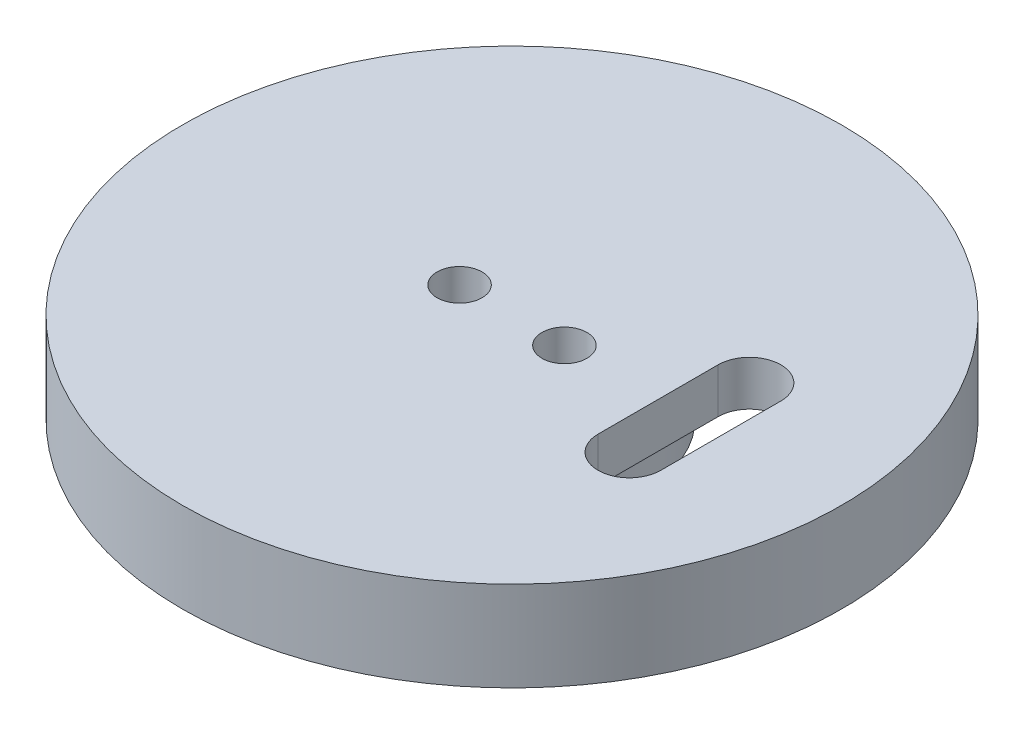
from build123d import *

# Parameters (mm, degrees)
ESQUISSE1_R             = 22
ESQUISSE1_R_2           = 1.5
BOSS_EXTRU_1_DEPTH      = 6
ESQUISSE2_R             = 16.25
ESQUISSE2_R_2           = 8.65
ENL_V_MAT_EXTRU_1_DEPTH = 3
ENL_V_MAT_EXTRU_2_DEPTH = 3


with BuildPart() as part:
    # Esquisse1 → Boss.-Extru.1 (new body)
    with BuildSketch(Plane(origin=(0, 0, 0), x_dir=(1, 0, 0), z_dir=(0, 1, 0))):
        Circle(ESQUISSE1_R)
        with Locations((-3.5, 0)):
            Circle(ESQUISSE1_R_2, mode=Mode.SUBTRACT)
        with Locations((3.5, 0)):
            Circle(ESQUISSE1_R_2, mode=Mode.SUBTRACT)
    extrude(amount=BOSS_EXTRU_1_DEPTH)

    # Esquisse2 → Enlèv. mat.-Extru.1 (cut)
    with BuildSketch(Plane.XZ):
        Circle(ESQUISSE2_R)
        Circle(ESQUISSE2_R_2, mode=Mode.SUBTRACT)
    extrude(amount=-ENL_V_MAT_EXTRU_1_DEPTH, mode=Mode.SUBTRACT)

    # Esquisse3 → Enlèv. mat.-Extru.2 (cut)
    with BuildSketch(Plane(origin=(0, 3, 0), x_dir=(-1, 0, 0), z_dir=(0, -1, 0))):
        with BuildLine():
            Line((-13.940625792, -4.008679646), (-13.940625792, 4.008679646))
            ThreePointArc((-13.940625792, 4.008679646), (-11.846146155, 6.103159283), (-9.751666518, 4.008679646))
            Line((-9.751666518, 4.008679646), (-9.751666518, -4.008679646))
            ThreePointArc((-9.751666518, -4.008679646), (-11.846146155, -6.103159283), (-13.940625792, -4.008679646))
        make_face()
    extrude(amount=-ENL_V_MAT_EXTRU_2_DEPTH, mode=Mode.SUBTRACT)


solid = part.part
